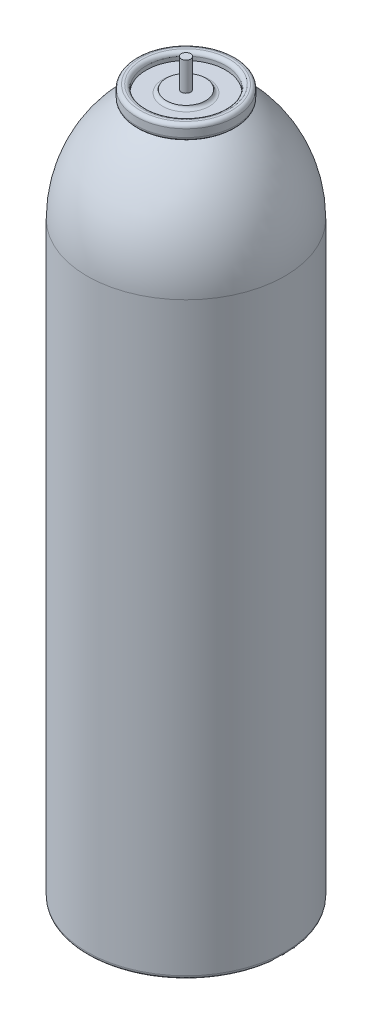
from build123d import *

# Parameters (mm, degrees)
SKETCH2_R           = 13.3604
CUT_EXTRUDE1_DEPTH  = 2.54
SKETCH3_R           = 6.611152939
BOSS_EXTRUDE1_DEPTH = 1.016
SKETCH4_R           = 1.5875
BOSS_EXTRUDE2_DEPTH = 9.652
SKETCH8_R           = 27.888803879
CUT_EXTRUDE2_DEPTH  = 7.112
FILLET1_R           = 5.08
FILLET4_R           = 1.27
FILLET5_R           = 1.27
FILLET6_R           = 1.27
FILLET7_R           = 1.27
FILLET8_R           = 1.27


with BuildPart() as part:
    # Sketch1 → Revolve1 (revolve)
    with BuildSketch(Plane.XY, mode=Mode.PRIVATE) as revolve1_sk:
        with BuildLine():
            Line((0, 233.045), (0, 0))
            Line((0, 0), (33.3375, 0))
            Line((33.3375, 0), (33.3375, 198.713653717))
            ThreePointArc((33.3375, 198.713653717), (28.574095551, 218.088078948), (15.369971666, 233.045))
            Line((15.369971666, 233.045), (0, 233.045))
        make_face()
        Polygon((0, 238.125), (0, 233.045), (15.369971666, 233.045), (16.6624, 233.045), (16.6624, 238.125), align=None)
    revolve(revolve1_sk.sketch.rotate(Axis((0, -195.980371031, 0), (0, 1, 0)), 90), axis=Axis((0, -195.980371031, 0), (0, 1, 0)))

    # Sketch2 → Cut-Extrude1 (cut)
    with BuildSketch(Plane(origin=(0, 238.125, 0), x_dir=(1, 0, 0), z_dir=(0, 1, 0))):
        with Locations(Location((0, 0, 0), (0, 0, 270))):
            Circle(SKETCH2_R)
    extrude(amount=-CUT_EXTRUDE1_DEPTH, mode=Mode.SUBTRACT)

    # Sketch3 → Boss-Extrude1 (add)
    with BuildSketch(Plane(origin=(0, 235.585, 0), x_dir=(1, 0, 0), z_dir=(0, 1, 0))):
        with Locations(Location((0, 0, 0), (0, 0, 270))):
            Circle(SKETCH3_R)
    extrude(amount=BOSS_EXTRUDE1_DEPTH)

    # Sketch4 → Boss-Extrude2 (add)
    with BuildSketch(Plane(origin=(0, 236.601, 0), x_dir=(1, 0, 0), z_dir=(0, 1, 0))):
        with Locations(Location((0, 0, 0), (0, 0, 270))):
            Circle(SKETCH4_R)
    extrude(amount=BOSS_EXTRUDE2_DEPTH)

    # Sketch8 → Cut-Extrude2 (cut)
    with BuildSketch(Plane.XZ):
        with Locations(Location((0, 0, 0), (0, 0, 270))):
            Circle(SKETCH8_R)
    extrude(amount=-CUT_EXTRUDE2_DEPTH, mode=Mode.SUBTRACT)

    # Fillet1
    fillet1_edges = [part.edges().sort_by_distance(p)[0] for p in [
        (0, 7.112, 27.888803879),
    ]]
    fillet(fillet1_edges, radius=FILLET1_R)

    # Fillet4
    fillet4_edges = [part.edges().sort_by_distance(p)[0] for p in [
        (0, 238.125, 16.6624),
        (0, 233.045, 16.6624),
    ]]
    fillet(fillet4_edges, radius=FILLET4_R)

    # Fillet5
    fillet5_edges = [part.edges().sort_by_distance(p)[0] for p in [
        (0, 238.125, -13.3604),
    ]]
    fillet(fillet5_edges, radius=FILLET5_R)

    # Fillet6
    fillet6_edges = [part.edges().sort_by_distance(p)[0] for p in [
        (0, 0, 33.3375),
    ]]
    fillet(fillet6_edges, radius=FILLET6_R)

    # Fillet7
    fillet7_edges = [part.edges().sort_by_distance(p)[0] for p in [
        (0, 0, 27.888803879),
    ]]
    fillet(fillet7_edges, radius=FILLET7_R)

    # Fillet8
    # the kernel refuses this fillet: 1.27 mm, written as the material it adds along each edge
    with BuildSketch(Plane(origin=(0, 235.585, 0), x_dir=(0, 0, 1), z_dir=(-1, 0, 0))) as fillet8_piece_1:
        with BuildLine():
            CenterArc((7.855493729, 1.27), FILLET8_R, 191.536959033, 78.463040967)
            Line((6.611152939, 1.016), (6.586266124, 1.01092))
            ThreePointArc((6.586266124, 1.01092), (6.585752939, 0.508), (6.585752939, 0))
            Line((6.585752939, 0), (6.611152939, -0.0254))
            Line((6.611152939, -0.0254), (7.855493729, -0.0254))
            Line((7.855493729, -0.0254), (7.855493729, 0))
        make_face()
    revolve(axis=Axis((0, 235.585, 0), (0, 1, 0)))


solid = part.part
